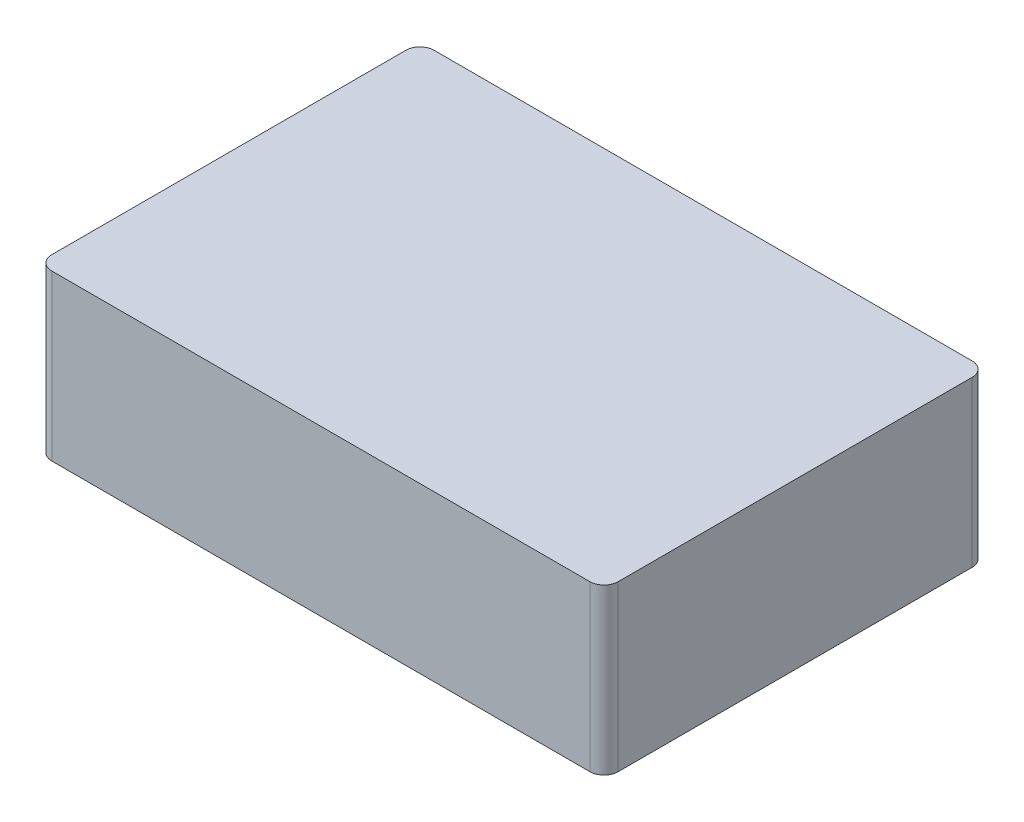
from build123d import *

# Parameters (mm, degrees)
SKETCH1_W           = 80
SKETCH1_H           = 54
BOSS_EXTRUDE2_DEPTH = 23.25
FILLET1_R           = 2


with BuildPart() as part:
    # Sketch1 → Boss-Extrude2 (new body)
    with BuildSketch(Plane(origin=(0, 0, 0), x_dir=(1, 0, 0), z_dir=(0, 1, 0))):
        with Locations((40, 27)):
            Rectangle(SKETCH1_W, SKETCH1_H)
    extrude(amount=BOSS_EXTRUDE2_DEPTH)

    # Fillet1
    fillet1_edges = [part.edges().sort_by_distance(p)[0] for p in [
        (0, 11.625, -54),
        (0, 11.625, 0),
        (80, 11.625, -54),
        (80, 11.625, 0),
    ]]
    fillet(fillet1_edges, radius=FILLET1_R)


solid = part.part
